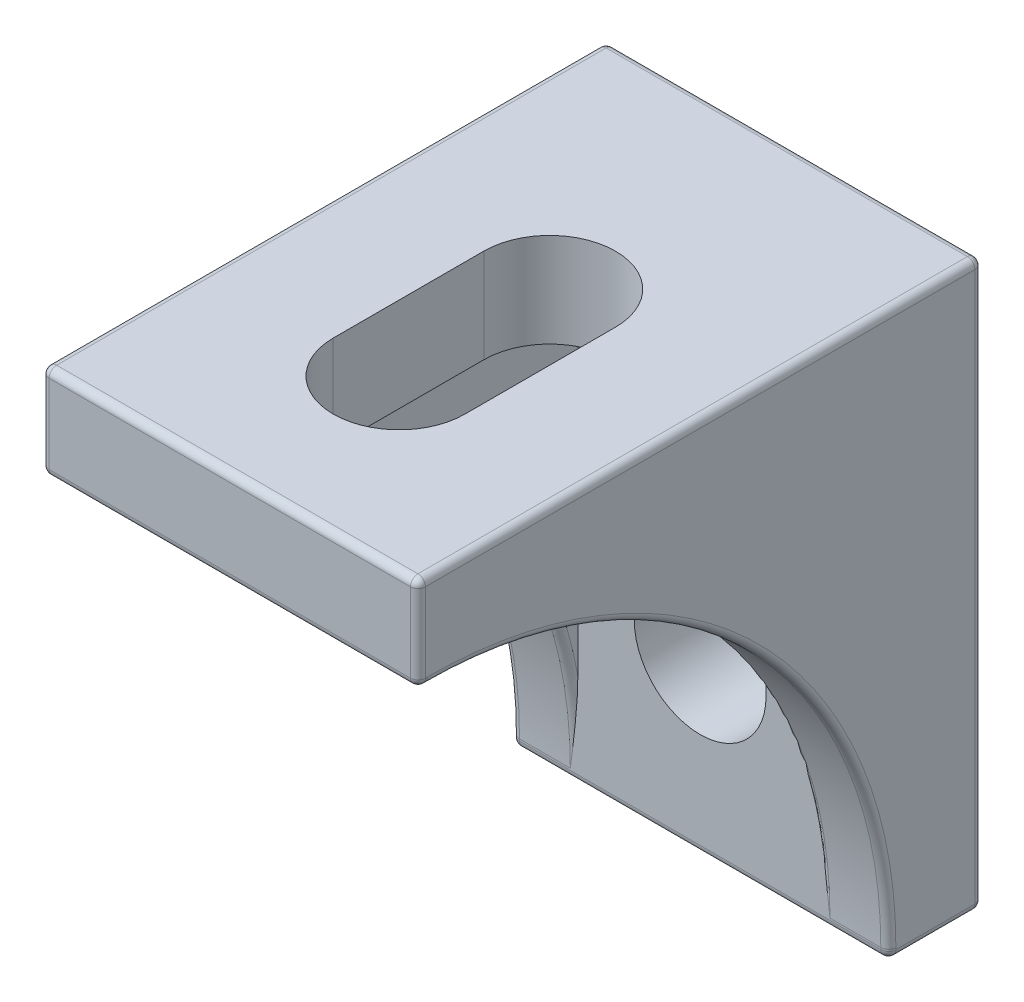
from build123d import *

# Parameters (mm, degrees)
SKETCH_1_W               = 20
SKETCH_1_H               = 25
EXTRUDE_1_DEPTH          = 5
SKETCH_1_3_W             = 20
SKETCH_1_3_H             = 5
EXTRUDE_2_DEPTH          = 30
EXTRUDE_3_DEPTH          = 20
CUT_EXTRUDE_2_DEPTH      = 47.904157598
CUT_EXTRUDE_2_DEPTH_BACK = 47.904157598
CUT_EXTRUDE_3_DEPTH      = 20
CUT_EXTRUDE_5_DEPTH      = 25
FILLET_3_R               = 0.4
FILLET_4_R               = 0.4
FILLET_5_R               = 0.4


with BuildPart() as part:
    # 스케치1 → 보스-돌출1 (new body)
    with BuildSketch(Plane.XY):
        with Locations((10, -17.5)):
            Rectangle(SKETCH_1_W, SKETCH_1_H)
        with BuildLine():
            ThreePointArc((6.5, -13), (10, -9.5), (13.5, -13))
            Line((13.5, -13), (13.5, -21))
            ThreePointArc((13.5, -21), (10, -24.5), (6.5, -21))
            Line((6.5, -21), (6.5, -13))
        make_face(mode=Mode.SUBTRACT)
    extrude(amount=EXTRUDE_1_DEPTH)

    # 스케치1<3> → 보스-돌출2 (add)
    with BuildSketch(Plane.XY):
        with Locations((10, -2.5)):
            Rectangle(SKETCH_1_3_W, SKETCH_1_3_H)
    extrude(amount=EXTRUDE_2_DEPTH)

    # 스케치3 → 보스-돌출3 (add)
    with BuildSketch(Plane.ZY):
        with BuildLine():
            Line((29.5, -5), (5, -5))
            Line((5, -5), (5, -29.5))
            ThreePointArc((5, -29.5), (12.175883861, -12.175883861), (29.5, -5))
        make_face()
    extrude(amount=-EXTRUDE_3_DEPTH)

    # 스케치1<4> → 컷-돌출2 (cut, two sides: drawn at the far end of the back side and taken through both)
    with BuildSketch(Plane.XY.offset(-CUT_EXTRUDE_2_DEPTH_BACK)):
        with BuildLine():
            Line((13.5, -13), (13.5, -21))
            ThreePointArc((13.5, -21), (10, -24.5), (6.5, -21))
            Line((6.5, -21), (6.5, -13))
            ThreePointArc((6.5, -13), (10, -9.5), (13.5, -13))
        make_face()
    extrude(amount=CUT_EXTRUDE_2_DEPTH + CUT_EXTRUDE_2_DEPTH_BACK, mode=Mode.SUBTRACT)

    # 스케치2 → 컷-돌출3 (cut)
    with BuildSketch(Plane(origin=(0, 0, 0), x_dir=(1, 0, 0), z_dir=(0, 1, 0))):
        with BuildLine():
            Line((13.5, -13), (13.5, -21))
            ThreePointArc((13.5, -21), (10, -24.5), (6.5, -21))
            Line((6.5, -21), (6.5, -13))
            ThreePointArc((6.5, -13), (10, -9.5), (13.5, -13))
        make_face()
    extrude(amount=-CUT_EXTRUDE_3_DEPTH, mode=Mode.SUBTRACT)

    # 스케치4 → 컷-돌출5 (cut)
    with BuildSketch(Plane.XY.offset(30)):
        Polygon((16.5, -30), (16.5, -5), (3.5, -5), (3.5, -30), (15.014148291, -30), align=None)
    extrude(amount=-CUT_EXTRUDE_5_DEPTH, mode=Mode.SUBTRACT)

    # 필렛3
    fillet_3_edges = [part.edges().sort_by_distance(p)[0] for p in [
        (0, -5, 29.75),
        (0, -12.175883861, 12.175883861),
        (0, -29.75, 5),
    ]]
    fillet(fillet_3_edges, radius=FILLET_3_R)
    fillet_3_2_edges = [part.edges().sort_by_distance(p)[0] for p in [
        (20, -29.75, 5),
        (20, -12.175883861, 12.175883861),
        (20, -5, 29.75),
    ]]
    fillet(fillet_3_2_edges, radius=FILLET_3_R)
    fillet_3_3_edges = [part.edges().sort_by_distance(p)[0] for p in [
        (3.5, -12.175883861, 12.175883861),
    ]]
    fillet(fillet_3_3_edges, radius=FILLET_3_R)
    fillet_3_4_edges = [part.edges().sort_by_distance(p)[0] for p in [
        (16.5, -12.175883861, 12.175883861),
    ]]
    fillet(fillet_3_4_edges, radius=FILLET_3_R)

    # 필렛4
    fillet_4_edges = [part.edges().sort_by_distance(p)[0] for p in [
        (0, -30, 2.3),
        (0.117157288, -30, 4.882842712),
        (20, -30, 2.3),
        (19.882842712, -30, 4.882842712),
        (0, -2.3, 30),
        (0.117157288, -4.882842712, 30),
        (20, -2.3, 30),
        (19.882842712, -4.882842712, 30),
        (10, -30, 5),
        (10, -5, 30),
        (10, 0, 30),
        (0, 0, 15),
        (20, 0, 15),
    ]]
    fillet(fillet_4_edges, radius=FILLET_4_R)

    # 필렛5
    fillet_5_edges = [part.edges().sort_by_distance(p)[0] for p in [
        (0.117157288, -0.117157288, 0),
        (0.117157288, -29.882842712, 0),
        (10, -30, 0),
        (19.882842712, -29.882842712, 0),
        (19.882842712, -0.117157288, 0),
        (0, -15, 0),
        (20, -15, 0),
        (10, 0, 0),
    ]]
    fillet(fillet_5_edges, radius=FILLET_5_R)


solid = part.part
